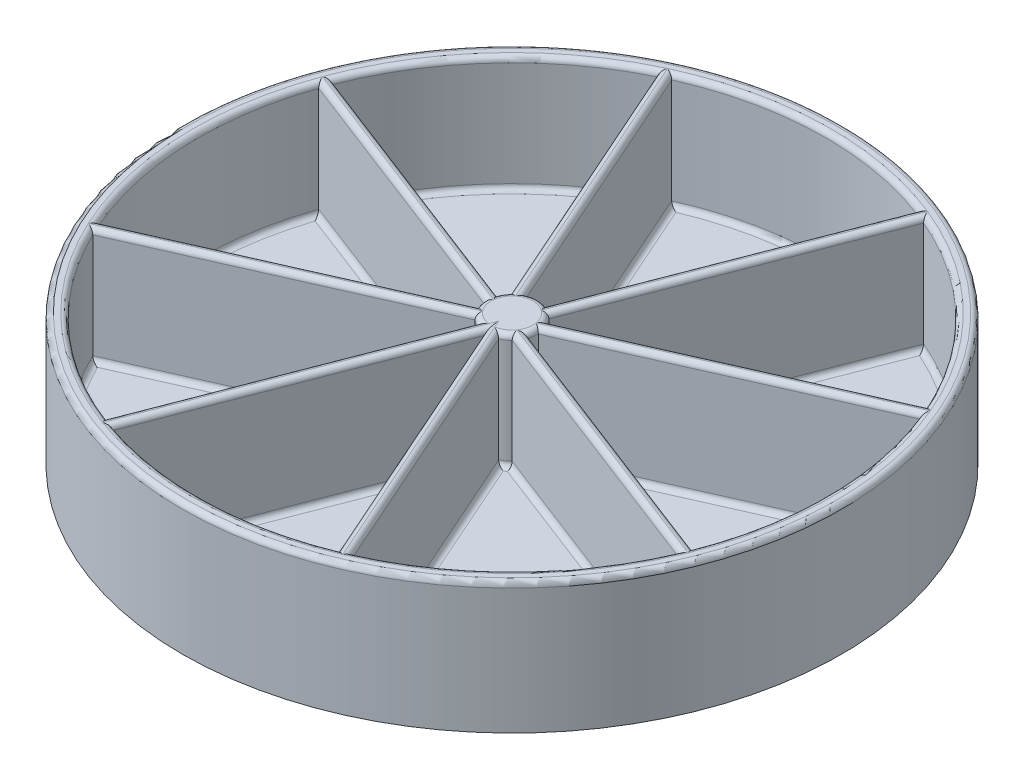
from build123d import *

# Parameters (mm, degrees)
SKETCH1_R           = 63
BOSS_EXTRUDE1_DEPTH = 25
SKETCH2_R           = 60
CUT_EXTRUDE1_DEPTH  = 22
EXTRUDE_THIN2_DEPTH = 22
SKETCH4_R           = 5
BOSS_EXTRUDE2_DEPTH = 25
FILLET1_R           = 1
SKETCH5_W           = 6.3
SKETCH5_H           = 2.8
CUT_EXTRUDE2_DEPTH  = 6


with BuildPart() as part:
    # Sketch1 → Boss-Extrude1 (new body)
    with BuildSketch(Plane(origin=(0, 0, 0), x_dir=(1, 0, 0), z_dir=(0, 1, 0))):
        with Locations(Location((0, 0, 0), (0, 0, 270))):
            Circle(SKETCH1_R)
    extrude(amount=BOSS_EXTRUDE1_DEPTH)

    # Sketch2 → Cut-Extrude1 (cut)
    with BuildSketch(Plane(origin=(0, 25, 0), x_dir=(1, 0, 0), z_dir=(0, 1, 0))):
        with Locations(Location((0, 0, 0), (0, 0, 270))):
            Circle(SKETCH2_R)
    extrude(amount=-CUT_EXTRUDE1_DEPTH, mode=Mode.SUBTRACT)

    # Sketch3 → Extrude-Thin2 (add)
    with BuildSketch(Plane(origin=(0, 3, 0), x_dir=(1, 0, 0), z_dir=(0, 1, 0))):
        Polygon((-24.31689002, 54.851516476), (24.31689002, -54.851516476), (22.488506138, -55.662079477), (-26.145273903, 54.040953476), align=None)
        Polygon((-21.591241428, -55.980517089), (21.591241428, 55.980517089), (23.457258664, 55.260809042), (-19.725224192, -56.700225137), align=None)
        Polygon((-54.851516476, -24.31689002), (54.851516476, 24.31689002), (55.662079477, 22.488506138), (-54.040953476, -26.145273903), align=None)
        Polygon((-55.980517089, 21.591241428), (55.980517089, -21.591241428), (55.260809042, -23.457258664), (-56.700225137, 19.725224192), align=None)
    extrude(amount=EXTRUDE_THIN2_DEPTH)

    # Sketch4 → Boss-Extrude2 (add)
    with BuildSketch(Plane.XZ):
        Circle(SKETCH4_R)
    extrude(amount=-BOSS_EXTRUDE2_DEPTH)

    # Fillet1
    fillet1_edges = [part.edges().sort_by_distance(p)[0] for p in [
        (59.998119218, 3, -0.475068788),
        (42.089152596, 3, -42.761001318),
        (11.695255773, 3, -30.32278009),
        (30.32278009, 3, 11.695255773),
        (29.711238091, 3, -13.171648761),
        (13.171648761, 3, 29.711238091),
        (-1.475110389, 3, -59.981864337),
        (29.39278734, 3, 13.480167868),
        (13.480167868, 3, -29.39278734),
        (30.315757357, 3, -11.251921135),
        (-44.140210357, 3, -40.640396524),
        (-28.694631356, 3, 14.9086889),
        (-30.832203435, 3, -9.748133395),
        (-14.9086889, 3, -28.694631356),
        (-59.948942039, 3, 2.474742094),
        (-4.867937199, 3, 1.14157235),
        (-4.249364954, 3, -2.634937853),
        (2.84063217, 3, 4.114706414),
        (-2.634937853, 3, 4.249364954),
        (-40.640396524, 3, 44.140210357),
        (4.114706414, 3, -2.84063217),
        (4.918167078, 3, 0.900906538),
        (-0.122925866, 3, -4.998488695),
        (1.475110389, 3, 59.981864337),
        (-9.792368708, 3, 30.946894187),
        (-13.171648761, 3, -29.711238091),
        (-11.695255773, 3, 30.32278009),
        (-29.711238091, 3, 13.171648761),
        (-30.32278009, 3, -11.695255773),
        (11.301740653, 3, 30.428135055),
        (42.761001318, 3, 42.089152596),
    ]]
    fillet(fillet1_edges, radius=FILLET1_R)
    fillet1_2_edges = [part.edges().sort_by_distance(p)[0] for p in [
        (11.695255773, 25, -30.32278009),
        (30.32278009, 25, 11.695255773),
        (29.711238091, 25, -13.171648761),
        (13.171648761, 25, 29.711238091),
        (29.39278734, 25, 13.480167868),
        (13.480167868, 25, -29.39278734),
        (30.315757357, 25, -11.251921135),
        (-4.867937199, 25, 1.14157235),
        (-4.249364954, 25, -2.634937853),
        (2.84063217, 25, 4.114706414),
        (-2.634937853, 25, 4.249364954),
        (4.114706414, 25, -2.84063217),
        (4.918167078, 25, 0.900906538),
        (-0.122925866, 25, -4.998488695),
        (42.761001318, 25, 42.089152596),
        (59.998119218, 25, -0.475068788),
        (42.089152596, 25, -42.761001318),
        (-1.475110389, 25, -59.981864337),
        (-44.140210357, 25, -40.640396524),
        (-59.948942039, 25, 2.474742094),
        (-40.640396524, 25, 44.140210357),
        (1.475110389, 25, 59.981864337),
        (-14.9086889, 25, -28.694631356),
        (-30.832203435, 25, -9.748133395),
        (-28.694631356, 25, 14.9086889),
        (-9.792368708, 25, 30.946894187),
        (11.301740653, 25, 30.428135055),
        (0, 25, -63),
        (-13.171648761, 25, -29.711238091),
        (-29.711238091, 25, 13.171648761),
        (-30.32278009, 25, -11.695255773),
        (-11.695255773, 25, 30.32278009),
    ]]
    fillet(fillet1_2_edges, radius=FILLET1_R - 0.0001)  # a hair under: the kernel refuses the full size

    # Sketch5 → Cut-Extrude2 (cut)
    with BuildSketch(Plane.XZ):
        Rectangle(SKETCH5_W, SKETCH5_H)
    extrude(amount=-CUT_EXTRUDE2_DEPTH, mode=Mode.SUBTRACT)


solid = part.part
